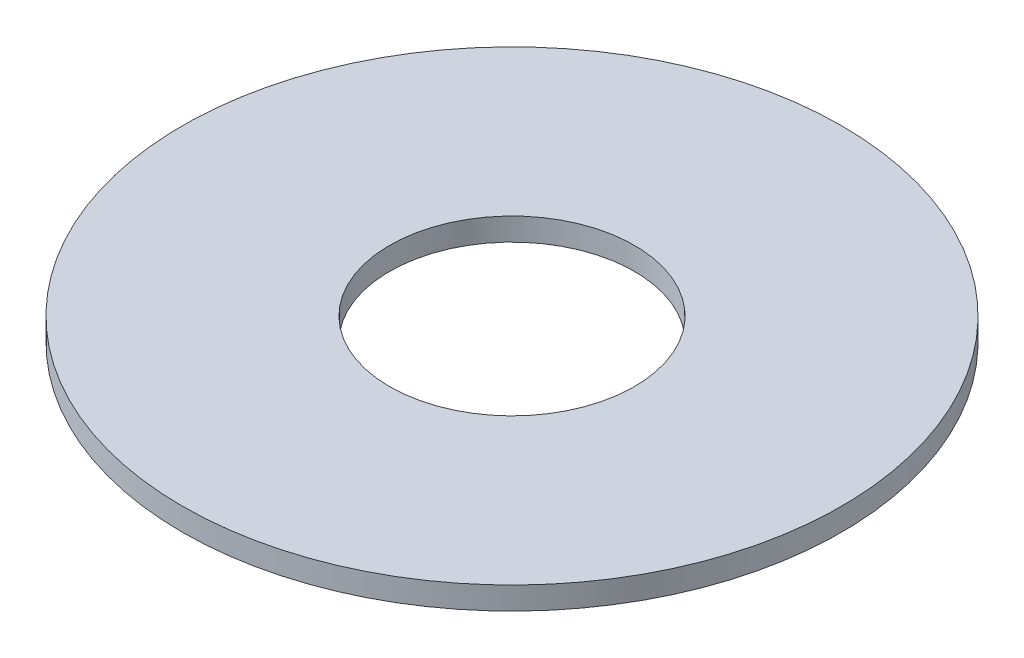
from build123d import *

# Parameters (mm, degrees)
SKETCH1_R           = 87.5
BOSS_EXTRUDE1_DEPTH = 6
SKETCH2_R           = 32.5
CUT_EXTRUDE1_DEPTH  = 124.889063278


with BuildPart() as part:
    # Sketch1 → Boss-Extrude1 (new body)
    with BuildSketch(Plane(origin=(0, 0, 0), x_dir=(1, 0, 0), z_dir=(0, 1, 0))):
        Circle(SKETCH1_R)
    extrude(amount=BOSS_EXTRUDE1_DEPTH)

    # Sketch2 → Cut-Extrude1 (cut, through all)
    with BuildSketch(Plane(origin=(0, 0, 0), x_dir=(1, 0, 0), z_dir=(0, 1, 0))):
        Circle(SKETCH2_R)
    extrude(amount=CUT_EXTRUDE1_DEPTH, mode=Mode.SUBTRACT)


solid = part.part
